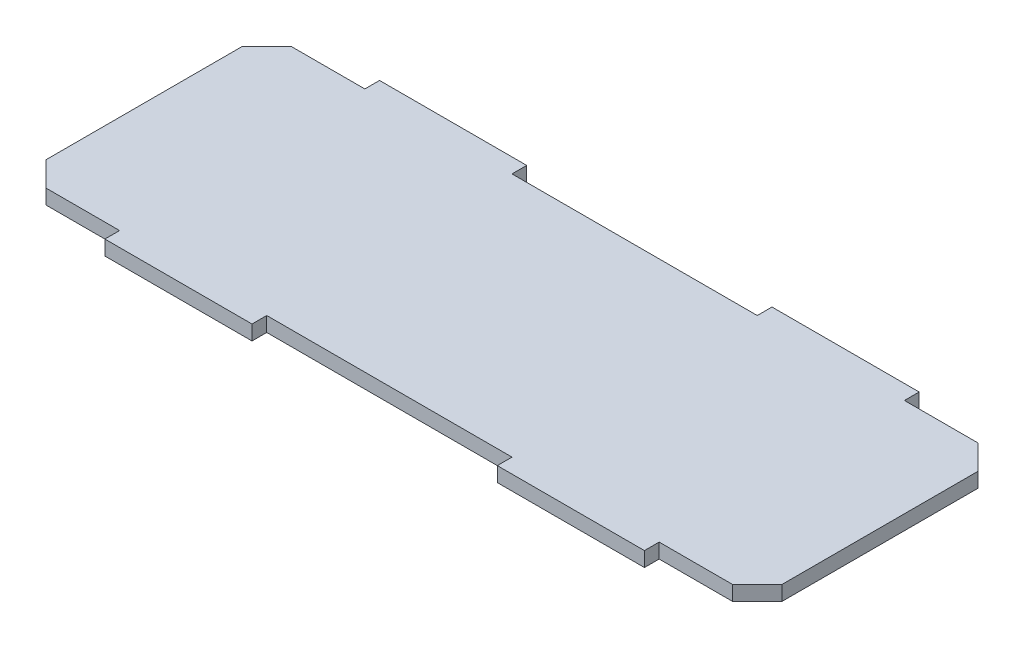
from build123d import *

# Parameters (mm, degrees)
SALIENTE_EXTRUIR1_DEPTH = 3


with BuildPart() as part:
    # Croquis1 → Saliente-Extruir1 (new body)
    with BuildSketch(Plane(origin=(0, 0, 0), x_dir=(1, 0, 0), z_dir=(0, 1, 0))):
        Polygon((-70, -25), (-55, -25), (-55, -28), (-25, -28), (-25, -25), (25, -25), (25, -28), (55, -28), (55, -25), (70, -25), (75, -20), (75, 20), (70, 25), (55, 25), (55, 28), (25, 28), (25, 25), (-25, 25), (-25, 28), (-55, 28), (-55, 25), (-70, 25), (-75, 20), (-75, -20), align=None)
    extrude(amount=SALIENTE_EXTRUIR1_DEPTH)


solid = part.part
